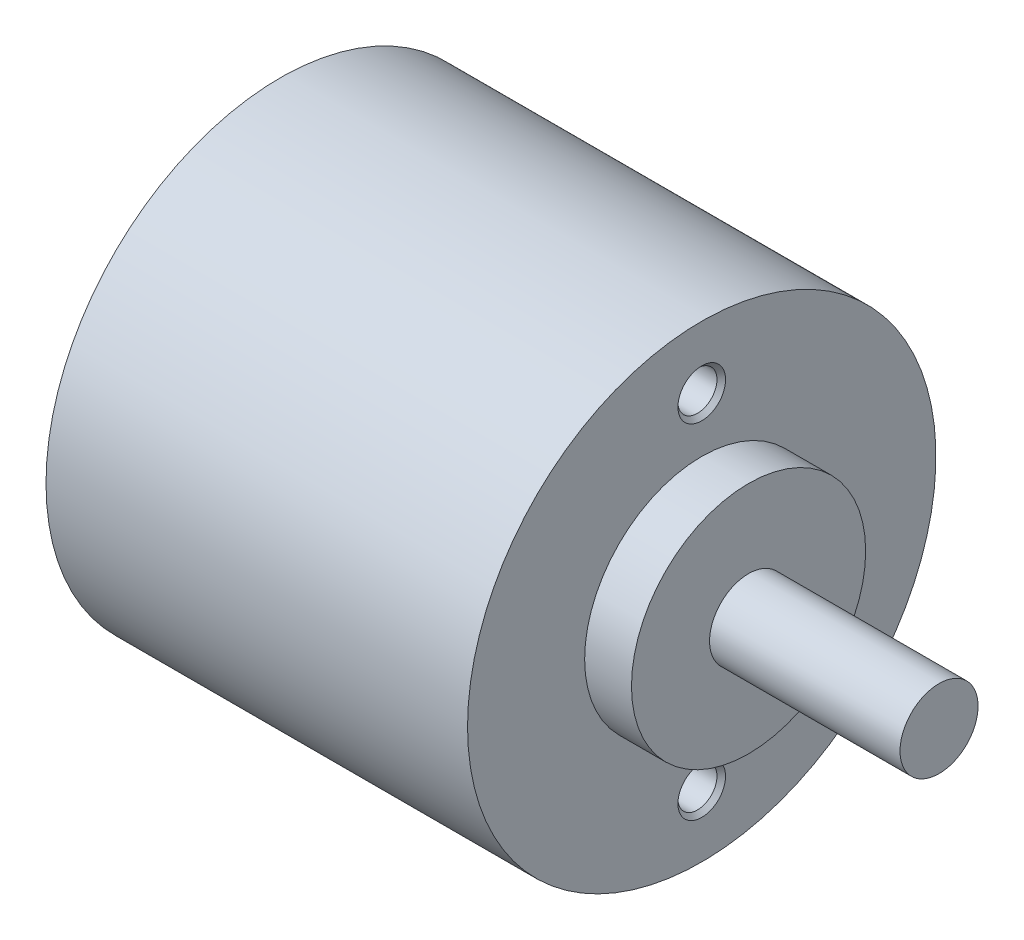
from build123d import *

# Parameters (mm, degrees)
TROU_TARAUD_M3X0_51_D           = 2.5
TROU_TARAUD_M3X0_51_DEPTH       = 8.5
TROU_TARAUD_M3X0_51_CSINK_D     = 3.05
TROU_TARAUD_M3X0_51_CSINK_ANGLE = 90
TROU_TARAUD_M3X0_51_TIP         = 0.751075774


with BuildPart() as part:
    # Esquisse1 → Révolution1 (revolve)
    with BuildSketch(Plane.XY):
        Polygon((15.2, 2.5), (15.2, 0), (-27, 0), (-27, 15), (0, 15), (0, 7.5), (3, 7.5), (3, 2.5), align=None)
    revolve(axis=Axis((-51.155053474, 0, 0), (1, 0, 0)))

    # Trou taraudé M3x0.51
    with Locations(Plane(origin=(0, 0, 0), x_dir=(0, 0, -1), z_dir=(1, 0, 0))):
        with Locations((0, 11), (0, -11)):
            CounterSinkHole(TROU_TARAUD_M3X0_51_D / 2, TROU_TARAUD_M3X0_51_CSINK_D / 2, depth=TROU_TARAUD_M3X0_51_DEPTH, counter_sink_angle=TROU_TARAUD_M3X0_51_CSINK_ANGLE)
            with Locations((0, 0, -(TROU_TARAUD_M3X0_51_DEPTH + TROU_TARAUD_M3X0_51_TIP / 2))):  # 118° drill point
                Cone(0, TROU_TARAUD_M3X0_51_D / 2, TROU_TARAUD_M3X0_51_TIP, mode=Mode.SUBTRACT)


solid = part.part
